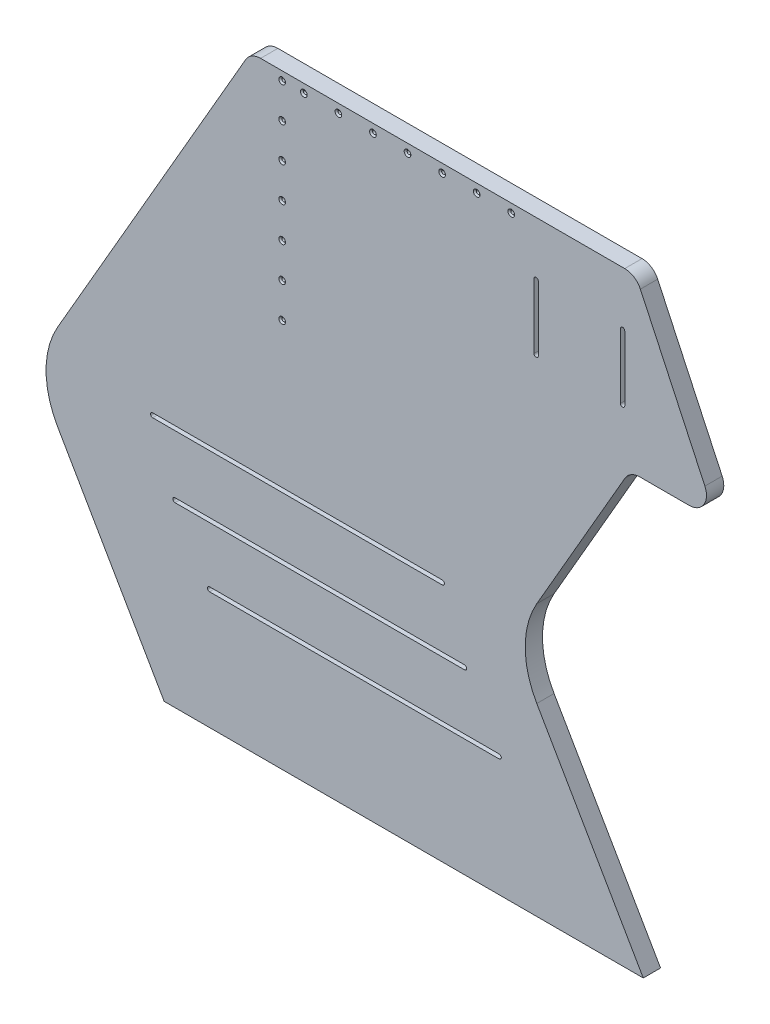
from build123d import *

# Parameters (mm, degrees)
BOSS_EXTRUDE1_DEPTH                                = 25.4
FILLET1_R                                          = 127
FILLET2_R                                          = 25.4
WHEEL_SLOT_DEPTH                                   = 25.4
PEDAL_SLOT_DEPTH                                   = 25.4
CSK_FOR_10_FLAT_HEAD_MACHINE_SCREW_100_D           = 5.1054
CSK_FOR_10_FLAT_HEAD_MACHINE_SCREW_100_CSINK_D     = 9.779
CSK_FOR_10_FLAT_HEAD_MACHINE_SCREW_100_CSINK_ANGLE = 100


# Read off the part's stored shape, not the designer's step: wheel slot, pedal slot
with BuildPart() as part:
    # Sketch1 → Boss-Extrude1 (new body)
    with BuildSketch(Plane.XY):
        Polygon((0, 0), (-193.132194655, 334.514773719), (-19.646968374, 635), (107.353031626, 635), (-11.089113546, 889), (-576.905448196, 889), (-897.037642851, 334.514773719), (-703.905448196, 0), align=None)
    extrude(amount=BOSS_EXTRUDE1_DEPTH)

    # Fillet1
    fillet1_edges = [part.edges().sort_by_distance(p)[0] for p in [
        (-897.037642851, 334.514773719, 12.7),
        (-193.132194655, 334.514773719, 12.7),
    ]]
    fillet(fillet1_edges, radius=FILLET1_R)

    # Fillet2
    fillet2_edges = [part.edges().sort_by_distance(p)[0] for p in [
        (-576.905448196, 889, 12.7),
        (-11.089113546, 889, 12.7),
        (107.353031626, 635, 12.7),
        (-19.646968374, 635, 12.7),
    ]]
    fillet(fillet2_edges, radius=FILLET2_R)

    # wheel slot outline → wheel slot (cut)
    with BuildSketch(Plane.XY):
        with BuildLine():
            Line((-154.207271537, 714.375), (-154.207271537, 809.625))
            ThreePointArc((-154.207271537, 809.625), (-157.382271537, 812.8), (-160.557271537, 809.625))
            Line((-160.557271537, 809.625), (-160.557271537, 714.375))
            ThreePointArc((-160.557271537, 714.375), (-157.382271537, 711.2), (-154.207271537, 714.375))
        make_face()
        with BuildLine():
            Line((-27.207271537, 714.375), (-27.207271537, 809.625))
            ThreePointArc((-27.207271537, 809.625), (-30.382271537, 812.8), (-33.557271537, 809.625))
            Line((-33.557271537, 809.625), (-33.557271537, 714.375))
            ThreePointArc((-33.557271537, 714.375), (-30.382271537, 711.2), (-27.207271537, 714.375))
        make_face()
    extrude(amount=WHEEL_SLOT_DEPTH, mode=Mode.SUBTRACT)

    # pedal slot outline → pedal slot (cut)
    with BuildSketch(Plane.XY):
        with BuildLine():
            Line((-720.725, 352.425), (-295.275, 352.425))
            ThreePointArc((-295.275, 352.425), (-292.1, 355.6), (-295.275, 358.775))
            Line((-295.275, 358.775), (-720.725, 358.775))
            ThreePointArc((-720.725, 358.775), (-723.9, 355.6), (-720.725, 352.425))
        make_face()
        with BuildLine():
            Line((-688.030448196, 260.789543073), (-262.580448196, 260.789543073))
            ThreePointArc((-262.580448196, 260.789543073), (-259.405448196, 263.964543073), (-262.580448196, 267.139543073))
            Line((-262.580448196, 267.139543073), (-688.030448196, 267.139543073))
            ThreePointArc((-688.030448196, 267.139543073), (-691.205448196, 263.964543073), (-688.030448196, 260.789543073))
        make_face()
        with BuildLine():
            Line((-637.230448196, 172.801362049), (-211.780448196, 172.801362049))
            ThreePointArc((-211.780448196, 172.801362049), (-208.605448196, 175.976362049), (-211.780448196, 179.151362049))
            Line((-211.780448196, 179.151362049), (-637.230448196, 179.151362049))
            ThreePointArc((-637.230448196, 179.151362049), (-640.405448196, 175.976362049), (-637.230448196, 172.801362049))
        make_face()
    extrude(amount=PEDAL_SLOT_DEPTH, mode=Mode.SUBTRACT)

    # CSK for #10 Flat Head Machine Screw (100)1 (through all)
    with Locations(Plane.XY.offset(25.4)):
        with Locations((-530.490751359, 876.3), (-530.490751359, 825.5), (-498.740751359, 876.3), (-447.940751359, 876.3), (-397.140751359, 876.3), (-346.340751359, 876.3), (-295.540751359, 876.3), (-244.740751359, 876.3), (-530.490751359, 774.7), (-530.490751359, 723.9), (-530.490751359, 673.1), (-530.490751359, 622.3), (-530.490751359, 571.5), (-193.940751359, 876.3)):
            CounterSinkHole(CSK_FOR_10_FLAT_HEAD_MACHINE_SCREW_100_D / 2, CSK_FOR_10_FLAT_HEAD_MACHINE_SCREW_100_CSINK_D / 2, counter_sink_angle=CSK_FOR_10_FLAT_HEAD_MACHINE_SCREW_100_CSINK_ANGLE)


solid = part.part
